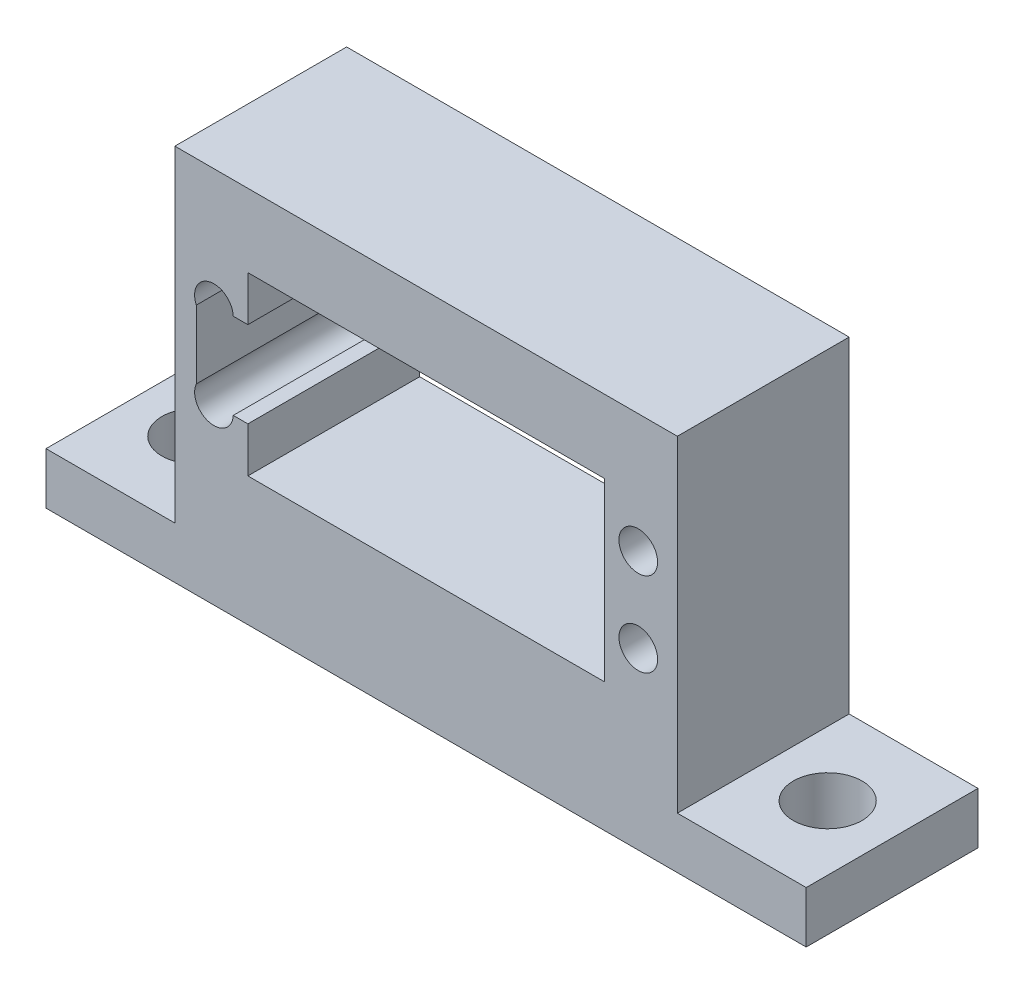
from build123d import *

# Parameters (mm, degrees)
SKETCH1_R           = 2.25
BOSS_EXTRUDE1_DEPTH = 20
SKETCH2_R           = 4
CUT_EXTRUDE1_DEPTH  = 62.660866844


with BuildPart() as part:
    # Sketch1 → Boss-Extrude1 (new body)
    with BuildSketch(Plane.XY):
        Polygon((-44.25, 0), (44.25, 0), (44.25, 6), (29.25, 6), (29.25, 44), (-29.25, 44), (-29.25, 6), (-44.25, 6), align=None)
        with Locations((24.7, 30.15)):
            Circle(SKETCH1_R, mode=Mode.SUBTRACT)
        with Locations((24.7, 20.35)):
            Circle(SKETCH1_R, mode=Mode.SUBTRACT)
        with BuildLine():
            Line((-20.75, 35.5), (20.75, 35.5))
            Line((20.75, 35.5), (20.75, 15))
            Line((20.75, 15), (-20.75, 15))
            Line((-20.75, 15), (-20.75, 20.25))
            Line((-20.75, 20.25), (-22.452223321, 20.25))
            ThreePointArc((-22.452223321, 20.25), (-25.223112795, 18.161655191), (-26.75, 21.27736185))
            Line((-26.75, 21.27736185), (-26.75, 29.22263815))
            ThreePointArc((-26.75, 29.22263815), (-25.223112795, 32.338344809), (-22.452223321, 30.25))
            Line((-22.452223321, 30.25), (-20.75, 30.25))
            Line((-20.75, 30.25), (-20.75, 35.5))
        make_face(mode=Mode.SUBTRACT)
    extrude(amount=BOSS_EXTRUDE1_DEPTH)

    # Sketch2 → Cut-Extrude1 (cut, through all)
    with BuildSketch(Plane(origin=(0, 6, 0), x_dir=(1, 0, 0), z_dir=(0, 1, 0))):
        with Locations((36.75, -10)):
            Circle(SKETCH2_R)
        with Locations((-36.75, -10)):
            Circle(SKETCH2_R)
    extrude(amount=-CUT_EXTRUDE1_DEPTH, mode=Mode.SUBTRACT)


solid = part.part
